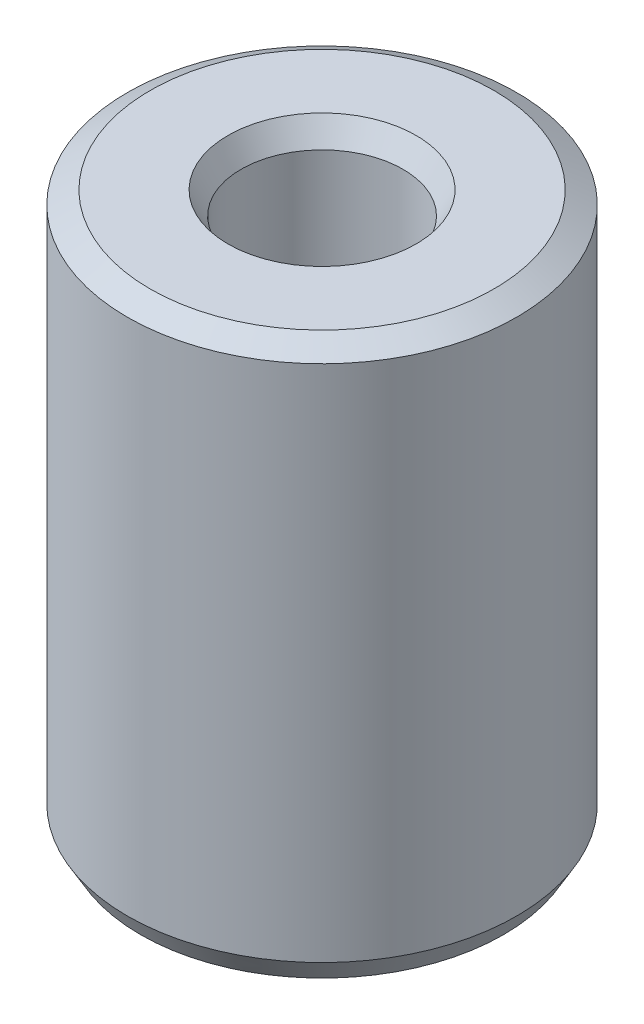
from build123d import *
from OCP.BRepFilletAPI import BRepFilletAPI_MakeChamfer

# Parameters (mm, degrees)
SKETCH1_R           = 47.5
BOSS_EXTRUDE1_DEPTH = 135.294523356
SKETCH2_R           = 19.755315073
CUT_EXTRUDE1_DEPTH  = 152.053328497
CHAMFER1_SIZE       = 3.200969047
CHAMFER1_SIZE2      = 5.544241023


with BuildPart() as part:
    # Sketch1 → Boss-Extrude1 (new body)
    with BuildSketch(Plane(origin=(0, 0, 0), x_dir=(1, 0, 0), z_dir=(0, 1, 0))):
        Circle(SKETCH1_R)
    extrude(amount=BOSS_EXTRUDE1_DEPTH)

    # Sketch2 → Cut-Extrude1 (cut, through all)
    with BuildSketch(Plane(origin=(0, 0, 0), x_dir=(1, 0, 0), z_dir=(0, 1, 0))):
        Circle(SKETCH2_R)
    extrude(amount=CUT_EXTRUDE1_DEPTH, mode=Mode.SUBTRACT)

    # Chamfer1: one chamfer whose edges measure the first distance from different faces: ONE call of the kernel's chamfer builder (chamfer() names one face for all edges)
    chamfer1_edges_1 = [part.edges().sort_by_distance(p)[0] for p in [
        (-19.755315073, 135.294523356, 0),
    ]]
    chamfer1_side_1 = [part.faces().sort_by_distance(p)[0] for p in [
        (-46.156497116, 135.294523356, 0),
    ]]
    chamfer1_edges_2 = [part.edges().sort_by_distance(p)[0] for p in [
        (-19.755315073, 0, 0),
    ]]
    chamfer1_side_2 = [part.faces().sort_by_distance(p)[0] for p in [
        (-19.755315073, 67.647261678, 0),
    ]]
    chamfer1_edges_3 = [part.edges().sort_by_distance(p)[0] for p in [
        (-47.5, 0, 0),
    ]]
    chamfer1_side_3 = [part.faces().sort_by_distance(p)[0] for p in [
        (-46.156497116, 0, 0),
    ]]
    chamfer1_edges_4 = [part.edges().sort_by_distance(p)[0] for p in [
        (-47.5, 135.294523356, 0),
    ]]
    chamfer1_side_4 = [part.faces().sort_by_distance(p)[0] for p in [
        (-47.5, 67.647261678, 0),
    ]]
    chamfer1 = BRepFilletAPI_MakeChamfer(part.part.solid().wrapped)
    for e in chamfer1_edges_1:
        chamfer1.Add(CHAMFER1_SIZE, CHAMFER1_SIZE2, e.wrapped, chamfer1_side_1[0].wrapped)  # the first distance lies on this face
    for e in chamfer1_edges_2:
        chamfer1.Add(CHAMFER1_SIZE, CHAMFER1_SIZE2, e.wrapped, chamfer1_side_2[0].wrapped)  # the first distance lies on this face
    for e in chamfer1_edges_3:
        chamfer1.Add(CHAMFER1_SIZE, CHAMFER1_SIZE2, e.wrapped, chamfer1_side_3[0].wrapped)  # the first distance lies on this face
    for e in chamfer1_edges_4:
        chamfer1.Add(CHAMFER1_SIZE, CHAMFER1_SIZE2, e.wrapped, chamfer1_side_4[0].wrapped)  # the first distance lies on this face
    add(Compound.cast(chamfer1.Shape()), mode=Mode.REPLACE)


solid = part.part
